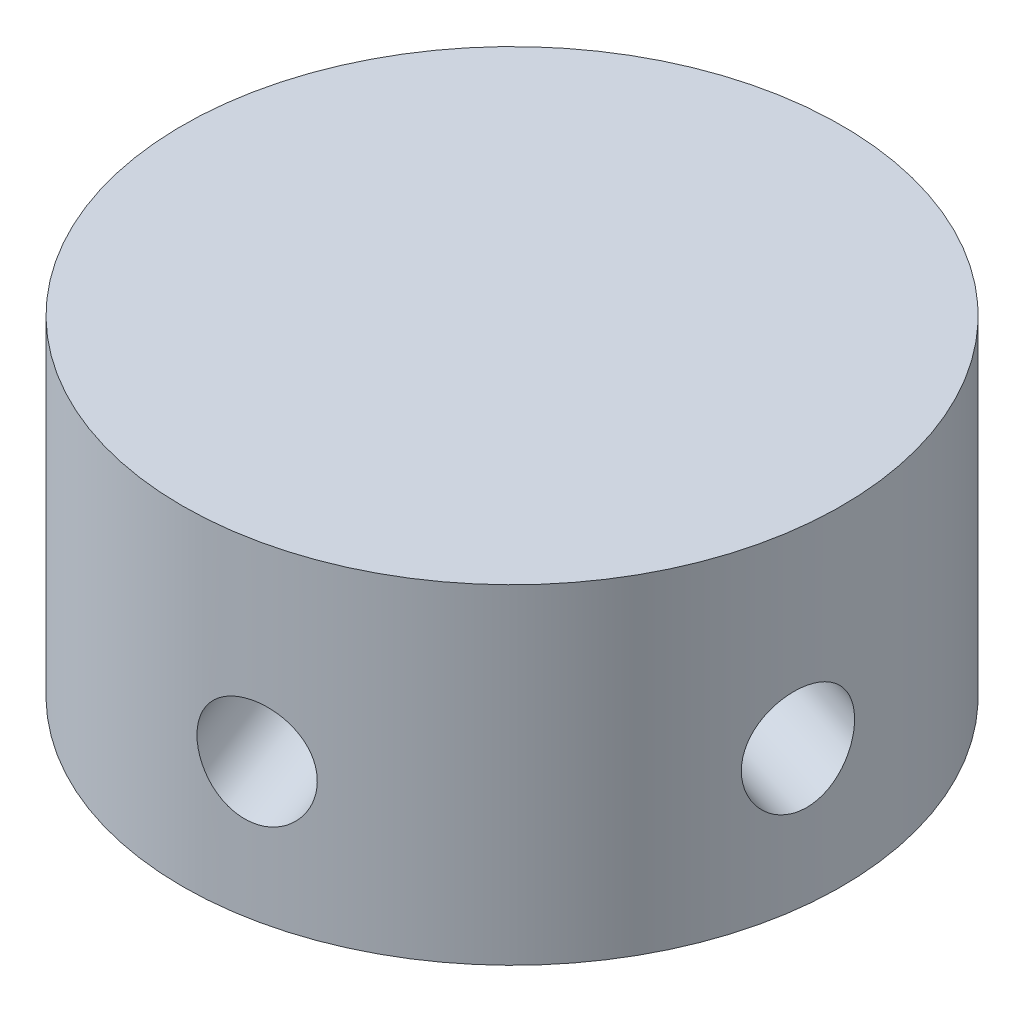
from build123d import *

# Parameters (mm, degrees)
BOSS_EXTRUDE1_DEPTH      = 3
BOSS_EXTRUDE1_DEPTH_BACK = 7
SKETCH1_R                = 10
SKETCH4_R                = 1.55
HOLE_DEPTH               = 19.828402711
HOLECIR_COUNT            = 5


with BuildPart() as part:
    # Sketch1 → Boss-Extrude1 (new, two sides: drawn at the far end of the back side and taken through both)
    with BuildSketch(Plane(origin=(0, 0, 0), x_dir=(1, 0, 0), z_dir=(0, 1, 0)).offset(-BOSS_EXTRUDE1_DEPTH_BACK)):
        Circle(SKETCH1_R)
    extrude(amount=BOSS_EXTRUDE1_DEPTH + BOSS_EXTRUDE1_DEPTH_BACK)

    # Sketch4 → hole (cut, through all)
    with BuildSketch(Plane(origin=(-3.352872105, -1.093066116, 1.887711608), x_dir=(-0.4486862613641547, -0.14627571033740308, -0.8816371449912632), z_dir=(0.8382180262940947, 0.2732665289126682, -0.47192790187872385))):
        Circle(SKETCH4_R)
    hole = extrude(amount=-HOLE_DEPTH, mode=Mode.SUBTRACT)

    # holecir: hole ×5 about axis
    holecir_axis = Axis((0, 5.5, 0), (0, -1, 0))
    for i in range(1, HOLECIR_COUNT):
        add(hole.rotate(holecir_axis, i * 360 / HOLECIR_COUNT), mode=Mode.SUBTRACT)


solid = part.part
